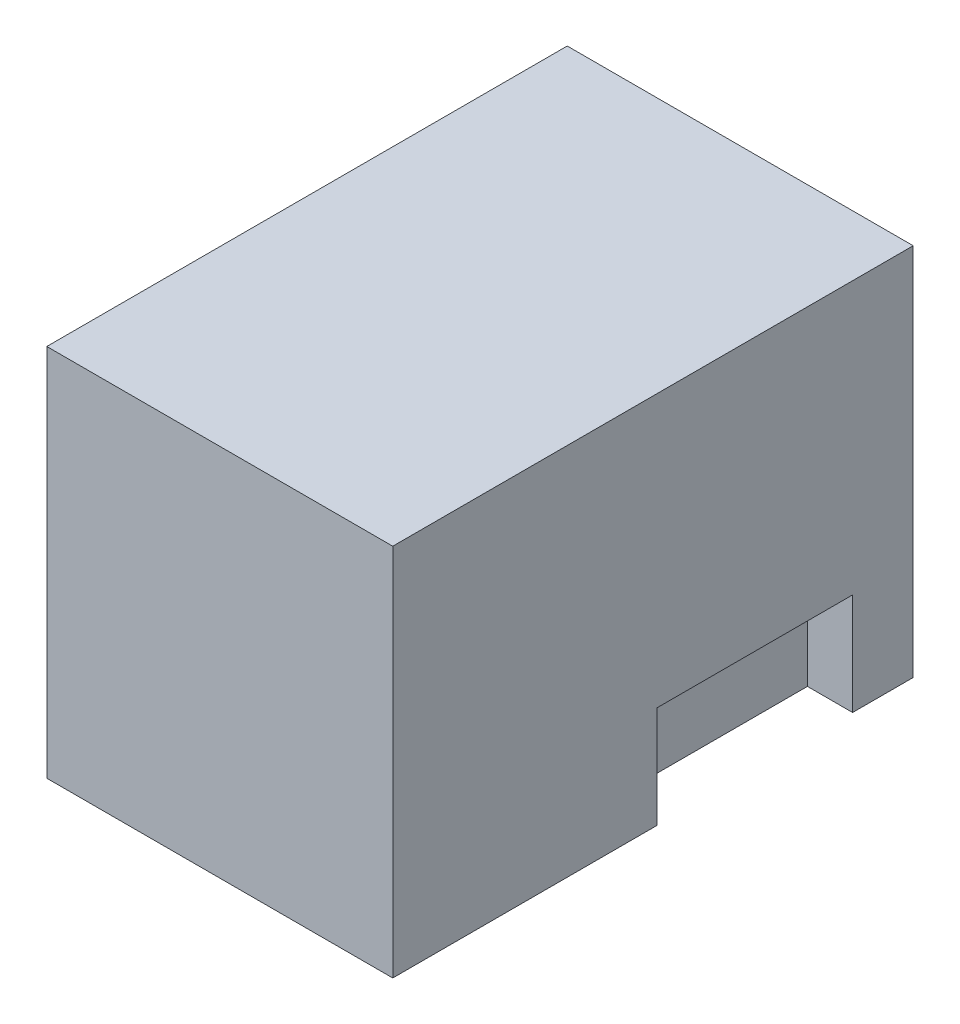
from build123d import *

# Parameters (mm, degrees)
SKETCH1_W                   = 217.5
SKETCH1_H                   = 327.2
BOSS_EXTRUDE1_DEPTH         = 235.1
SHELL1_T                    = -2
LEFT_WHEEL_SPACE_SKETCH_W   = 127
LEFT_WHEEL_SPACE_SKETCH_H   = 66.04
LEFT_WHEEL_SPACE_DEPTH      = 30
RIGHT_WHEEL_SPACE_SKETCH_W  = 127
RIGHT_WHEEL_SPACE_SKETCH_H  = 66.04
RIGHT_WHEEL_SPACE_DEPTH     = 30
SKETCH9_W                   = 123
SKETCH9_H                   = 64.04
LEFT_WHEEL_SPACE_CUT_DEPTH  = 28.4
SKETCH10_W                  = 123
SKETCH10_H                  = 64.04
RIGHT_WHEEL_SPACE_CUT_DEPTH = 28.4


with BuildPart() as part:
    # Sketch1 → Boss-Extrude1 (new body)
    with BuildSketch(Plane(origin=(0, 0, 0), x_dir=(1, 0, 0), z_dir=(0, 1, 0))):
        with Locations((108.75, 163.6)):
            Rectangle(SKETCH1_W, SKETCH1_H)
    extrude(amount=BOSS_EXTRUDE1_DEPTH)

    # Shell1
    shell1_openings = [part.faces().sort_by_distance(p)[0] for p in [
        (108.75, 117.55, -327.2),
    ]]
    offset(amount=SHELL1_T, openings=shell1_openings, kind=Kind.INTERSECTION)

    # Left_wheel_space_sketch → Left_wheel_space (add)
    with BuildSketch(Plane(origin=(217.5, 0, 0), x_dir=(0, 0, -1), z_dir=(1, 0, 0))):
        with Locations((227.6, 33.02)):
            Rectangle(LEFT_WHEEL_SPACE_SKETCH_W, LEFT_WHEEL_SPACE_SKETCH_H)
    extrude(amount=-LEFT_WHEEL_SPACE_DEPTH)

    # Right_wheel_space_sketch → Right_wheel_space (add)
    with BuildSketch(Plane.ZY):
        with Locations((-227.6, 33.02)):
            Rectangle(RIGHT_WHEEL_SPACE_SKETCH_W, RIGHT_WHEEL_SPACE_SKETCH_H)
    extrude(amount=-RIGHT_WHEEL_SPACE_DEPTH)

    # Sketch9 → Left_wheel_space_cut (cut)
    with BuildSketch(Plane(origin=(217.5, 0, 0), x_dir=(0, 0, -1), z_dir=(1, 0, 0))):
        with Locations((227.6, 32.02)):
            Rectangle(SKETCH9_W, SKETCH9_H)
    extrude(amount=-LEFT_WHEEL_SPACE_CUT_DEPTH, mode=Mode.SUBTRACT)

    # Sketch10 → Right_wheel_space_cut (cut)
    with BuildSketch(Plane.ZY):
        with Locations((-227.6, 32.02)):
            Rectangle(SKETCH10_W, SKETCH10_H)
    extrude(amount=-RIGHT_WHEEL_SPACE_CUT_DEPTH, mode=Mode.SUBTRACT)


solid = part.part
